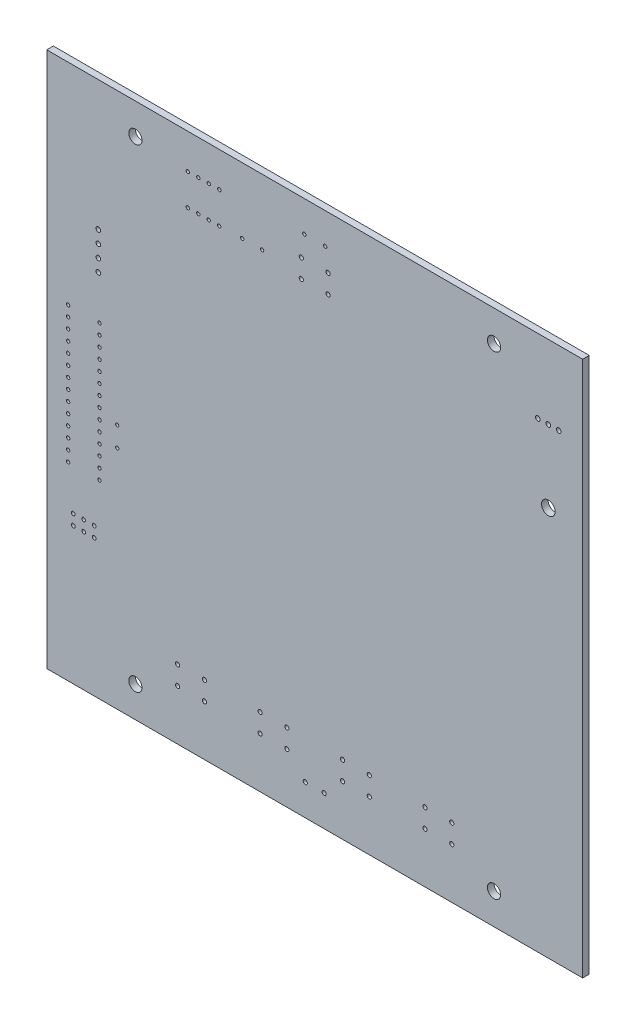
from build123d import *

# Parameters (mm, degrees)
SKIZZE1_W           = 130
SKIZZE1_H           = 130
BOARD_OUTLINE_DEPTH = 1.6
SKIZZE2_R           = 1.6
SKIZZE2_R_2         = 1.651
NPTH_DEPTH          = 188.390127808
SKIZZE3_R           = 0.405
SKIZZE3_R_2         = 0.56
SKIZZE3_R_3         = 0.51
SKIZZE3_R_4         = 0.455
PTH_DEPTH           = 188.390127808


with BuildPart() as part:
    # Skizze1 → Board_Outline (new body)
    with BuildSketch(Plane.XY):
        with Locations((67.5, 67.5)):
            Rectangle(SKIZZE1_W, SKIZZE1_H)
    extrude(amount=BOARD_OUTLINE_DEPTH)

    # Skizze2 → NPTH (cut, through all)
    with BuildSketch(Plane.XY):
        with Locations((24, 125)):
            Circle(SKIZZE2_R)
        with Locations((111, 10)):
            Circle(SKIZZE2_R)
        with Locations((24, 10)):
            Circle(SKIZZE2_R)
        with Locations((111, 125)):
            Circle(SKIZZE2_R)
        with Locations((124.17, 97.094)):
            Circle(SKIZZE2_R_2)
    extrude(amount=NPTH_DEPTH, mode=Mode.SUBTRACT)

    # Skizze3 → PTH (cut, through all)
    with BuildSketch(Plane.XY):
        with Locations((15.31, 81.51)):
            Circle(SKIZZE3_R)
        with Locations((15.31, 78.97)):
            Circle(SKIZZE3_R)
        with Locations((15.31, 76.43)):
            Circle(SKIZZE3_R)
        with Locations((15.31, 73.89)):
            Circle(SKIZZE3_R)
        with Locations((15.31, 71.35)):
            Circle(SKIZZE3_R)
        with Locations((15.31, 68.81)):
            Circle(SKIZZE3_R)
        with Locations((15.31, 66.27)):
            Circle(SKIZZE3_R)
        with Locations((15.31, 63.73)):
            Circle(SKIZZE3_R)
        with Locations((15.31, 61.19)):
            Circle(SKIZZE3_R)
        with Locations((15.31, 58.65)):
            Circle(SKIZZE3_R)
        with Locations((15.31, 56.11)):
            Circle(SKIZZE3_R)
        with Locations((15.31, 53.57)):
            Circle(SKIZZE3_R)
        with Locations((15.31, 51.03)):
            Circle(SKIZZE3_R)
        with Locations((15.31, 48.49)):
            Circle(SKIZZE3_R)
        with Locations((7.69, 48.49)):
            Circle(SKIZZE3_R)
        with Locations((7.69, 51.03)):
            Circle(SKIZZE3_R)
        with Locations((7.69, 53.57)):
            Circle(SKIZZE3_R)
        with Locations((7.69, 56.11)):
            Circle(SKIZZE3_R)
        with Locations((7.69, 58.65)):
            Circle(SKIZZE3_R)
        with Locations((7.69, 61.19)):
            Circle(SKIZZE3_R)
        with Locations((7.69, 63.73)):
            Circle(SKIZZE3_R)
        with Locations((7.69, 66.27)):
            Circle(SKIZZE3_R)
        with Locations((7.69, 68.81)):
            Circle(SKIZZE3_R)
        with Locations((7.69, 71.35)):
            Circle(SKIZZE3_R)
        with Locations((7.69, 73.89)):
            Circle(SKIZZE3_R)
        with Locations((7.69, 76.43)):
            Circle(SKIZZE3_R)
        with Locations((7.69, 78.97)):
            Circle(SKIZZE3_R)
        with Locations((7.69, 81.51)):
            Circle(SKIZZE3_R)
        with Locations((64.96, 125)):
            Circle(SKIZZE3_R)
        with Locations((70.04, 125)):
            Circle(SKIZZE3_R)
        with Locations((15.01, 92)):
            Circle(SKIZZE3_R_2)
        with Locations((15, 101)):
            Circle(SKIZZE3_R_2)
        with Locations((15.02, 95)):
            Circle(SKIZZE3_R_2)
        with Locations((15.01, 98.01)):
            Circle(SKIZZE3_R_2)
        with Locations((19.59, 62.2)):
            Circle(SKIZZE3_R)
        with Locations((19.59, 57.38)):
            Circle(SKIZZE3_R)
        with Locations((121.63, 114.62)):
            Circle(SKIZZE3_R_2)
        with Locations((124.17, 114.62)):
            Circle(SKIZZE3_R_2)
        with Locations((126.71, 114.62)):
            Circle(SKIZZE3_R_2)
        with Locations((54.74, 116.59)):
            Circle(SKIZZE3_R)
        with Locations((49.92, 116.59)):
            Circle(SKIZZE3_R)
        with Locations((44.34, 116.42)):
            Circle(SKIZZE3_R)
        with Locations((41.8, 116.42)):
            Circle(SKIZZE3_R)
        with Locations((39.26, 116.42)):
            Circle(SKIZZE3_R)
        with Locations((36.72, 116.42)):
            Circle(SKIZZE3_R)
        with Locations((36.72, 124.04)):
            Circle(SKIZZE3_R)
        with Locations((39.26, 124.04)):
            Circle(SKIZZE3_R)
        with Locations((41.8, 124.04)):
            Circle(SKIZZE3_R)
        with Locations((44.34, 124.04)):
            Circle(SKIZZE3_R)
        with Locations((70.75, 119.76)):
            Circle(SKIZZE3_R_3)
        with Locations((64.25, 119.76)):
            Circle(SKIZZE3_R_3)
        with Locations((70.75, 115.24)):
            Circle(SKIZZE3_R_3)
        with Locations((64.25, 115.24)):
            Circle(SKIZZE3_R_3)
        with Locations((34.25, 14.74)):
            Circle(SKIZZE3_R_3)
        with Locations((40.75, 14.74)):
            Circle(SKIZZE3_R_3)
        with Locations((34.25, 19.26)):
            Circle(SKIZZE3_R_3)
        with Locations((40.75, 19.26)):
            Circle(SKIZZE3_R_3)
        with Locations((54.25, 14.74)):
            Circle(SKIZZE3_R_3)
        with Locations((60.75, 14.74)):
            Circle(SKIZZE3_R_3)
        with Locations((54.25, 19.26)):
            Circle(SKIZZE3_R_3)
        with Locations((60.75, 19.26)):
            Circle(SKIZZE3_R_3)
        with Locations((74.25, 14.74)):
            Circle(SKIZZE3_R_3)
        with Locations((80.75, 14.74)):
            Circle(SKIZZE3_R_3)
        with Locations((74.25, 19.26)):
            Circle(SKIZZE3_R_3)
        with Locations((80.75, 19.26)):
            Circle(SKIZZE3_R_3)
        with Locations((94.25, 14.74)):
            Circle(SKIZZE3_R_3)
        with Locations((100.75, 14.74)):
            Circle(SKIZZE3_R_3)
        with Locations((94.25, 19.26)):
            Circle(SKIZZE3_R_3)
        with Locations((100.75, 19.26)):
            Circle(SKIZZE3_R_3)
        with Locations((65.21, 10)):
            Circle(SKIZZE3_R_3)
        with Locations((69.79, 10)):
            Circle(SKIZZE3_R_3)
        with Locations((8.92, 38.29)):
            Circle(SKIZZE3_R_4)
        with Locations((8.92, 35.75)):
            Circle(SKIZZE3_R_4)
        with Locations((11.46, 38.29)):
            Circle(SKIZZE3_R_4)
        with Locations((11.46, 35.75)):
            Circle(SKIZZE3_R_4)
        with Locations((14, 38.29)):
            Circle(SKIZZE3_R_4)
        with Locations((14, 35.75)):
            Circle(SKIZZE3_R_4)
    extrude(amount=PTH_DEPTH, mode=Mode.SUBTRACT)


solid = part.part
